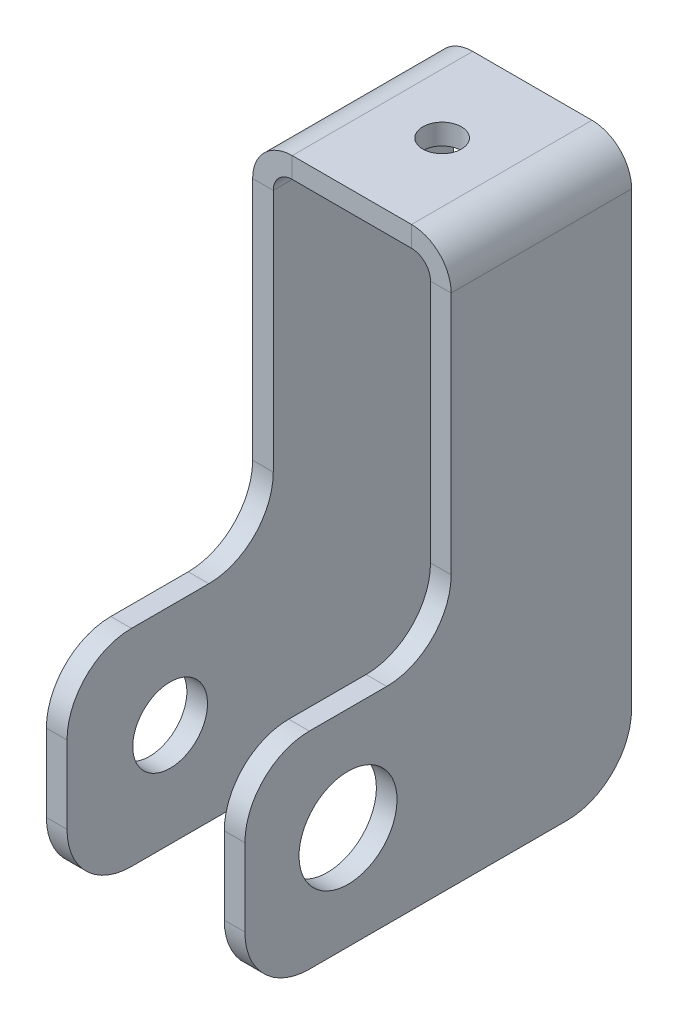
from build123d import *

# Parameters (mm, degrees)
SKETCH1_W                    = 7.7
SKETCH1_H                    = 7
BASE_FLANGE1_DEPTH           = 0.8
EDGE_FLANGE2_STRIP_W         = 4.6732
EDGE_FLANGE2_STRIP_H         = 0.8
EDGE_FLANGE2_STRIP_CUT_DEPTH = 7
EDGE_FLANGE2_DEPTH           = 7
EDGE_FLANGE2_FLAT_DEPTH      = 0.8
HOLE1_START                  = -1.85
HOLE1_OUTLINE_R              = 1.45
HOLE1_DEPTH                  = 0.8
HOLE4_START                  = -0.8
HOLE4_OUTLINE_R              = 0.75
HOLE4_DEPTH                  = 0.8
FILLET1_R                    = 2.5
SKETCH24_R                   = 1.9
CUT_EXTRUDE1_DEPTH           = 1


# Read off the part's stored shape, not the designer's step: Hole1, Hole4
# Sheet-metal steps are written as plain solids
with BuildPart() as part:
    # Sketch1 → Base-Flange1 (new body)
    with BuildSketch(Plane(origin=(0, 0, 0), x_dir=(1, 0, 0), z_dir=(0, 1, 0))):
        with Locations((2, -0.01953125)):
            Rectangle(SKETCH1_W, SKETCH1_H)
    extrude(amount=-BASE_FLANGE1_DEPTH)

    # Edge-Flange2 strip (across the edge) → Edge-Flange2 strip cut (cut)
    with BuildSketch(Plane(origin=(-1.85, -0.8, 3.51953125), x_dir=(1, 0, 0), z_dir=(0, 0, -1))):
        with Locations((-0.8, -0.4)):
            Rectangle(EDGE_FLANGE2_STRIP_W, EDGE_FLANGE2_STRIP_H)
    edge_flange2_strip_cut = extrude(amount=EDGE_FLANGE2_STRIP_CUT_DEPTH, mode=Mode.SUBTRACT)

    # Edge-Flange2 bend section (across the edge) → Edge-Flange2 (add)
    with BuildSketch(Plane(origin=(-1.85, -0.8, 3.51953125), x_dir=(1, 0, 0), z_dir=(0, 0, -1))):
        with BuildLine():
            Line((0, 0.7366), (0.8, 0.7366))
            ThreePointArc((0.8, 0.7366), (1.015745145, 0.215745145), (1.5366, 0))
            Line((1.5366, 0), (1.5366, -0.8))
            ThreePointArc((1.5366, -0.8), (0.45005972, -0.34994028), (0, 0.7366))
        make_face()
    edge_flange2 = extrude(amount=EDGE_FLANGE2_DEPTH)

    # Edge-Flange2 profile (on flange) → Edge-Flange2 flat (add)
    with BuildSketch(Plane(origin=(-1.85, -0.8, 0), x_dir=(0, 0, -1), z_dir=(-1, 0, 0))):
        with BuildLine():
            Line((3.48046875, 0.7366), (3.48046875, 20.7))
            Line((3.48046875, 20.7), (-3.51953125, 20.7))
            Line((-3.51953125, 20.7), (-11.51953125, 20.7))
            Line((-11.51953125, 20.7), (-11.51953125, 12.7))
            Line((-11.51953125, 12.7), (-6.01953125, 12.7))
            ThreePointArc((-6.01953125, 12.7), (-4.251764297, 11.967766953), (-3.51953125, 10.2))
            Line((-3.51953125, 10.2), (-3.51953125, 0.7366))
            Line((-3.51953125, 0.7366), (3.48046875, 0.7366))
        make_face()
    edge_flange2_flat = extrude(amount=-EDGE_FLANGE2_FLAT_DEPTH)

    # Hole1 outline → Hole1 (cut)
    with BuildSketch(Plane.YZ.offset(HOLE1_START)):
        with Locations((-17.5, 7.51953125)):
            Circle(HOLE1_OUTLINE_R)
    hole1 = extrude(amount=HOLE1_DEPTH, mode=Mode.SUBTRACT)

    # Hole4 outline → Hole4 (cut)
    with BuildSketch(Plane(origin=(0, 0, 0), x_dir=(1, 0, 0), z_dir=(0, 1, 0)).offset(HOLE4_START)):
        with Locations((2, -0.01953125)):
            Circle(HOLE4_OUTLINE_R)
    extrude(amount=HOLE4_DEPTH, mode=Mode.SUBTRACT)

    # Mirror1: Edge-Flange2 strip cut, Edge-Flange2, Edge-Flange2 flat, Hole1 across plane
    add(edge_flange2_strip_cut.mirror(Plane(origin=(2, 0, 0), x_dir=(0, 0, 1), z_dir=(1, 0, 0))), mode=Mode.SUBTRACT)
    add(edge_flange2.mirror(Plane(origin=(2, 0, 0), x_dir=(0, 0, 1), z_dir=(1, 0, 0))))
    add(edge_flange2_flat.mirror(Plane(origin=(2, 0, 0), x_dir=(0, 0, 1), z_dir=(1, 0, 0))))
    add(hole1.mirror(Plane(origin=(2, 0, 0), x_dir=(0, 0, 1), z_dir=(1, 0, 0))), mode=Mode.SUBTRACT)

    # Fillet1
    fillet1_edges = [part.edges().sort_by_distance(p)[0] for p in [
        (-1.45, -21.5, -3.48046875),
        (-1.45, -21.5, 11.51953125),
        (-1.45, -13.5, 11.51953125),
        (5.45, -21.5, -3.48046875),
        (5.45, -13.5, 11.51953125),
        (5.45, -21.5, 11.51953125),
    ]]
    fillet(fillet1_edges, radius=FILLET1_R)

    # Sketch24 → Cut-Extrude1 (cut)
    with BuildSketch(Plane(origin=(5.85, 0, 0), x_dir=(0, 0, -1), z_dir=(1, 0, 0))):
        with Locations(Location((-7.51953125, -17.5, 0), (0, 0, 90))):
            Circle(SKETCH24_R)
    extrude(amount=-CUT_EXTRUDE1_DEPTH, mode=Mode.SUBTRACT)


solid = part.part
